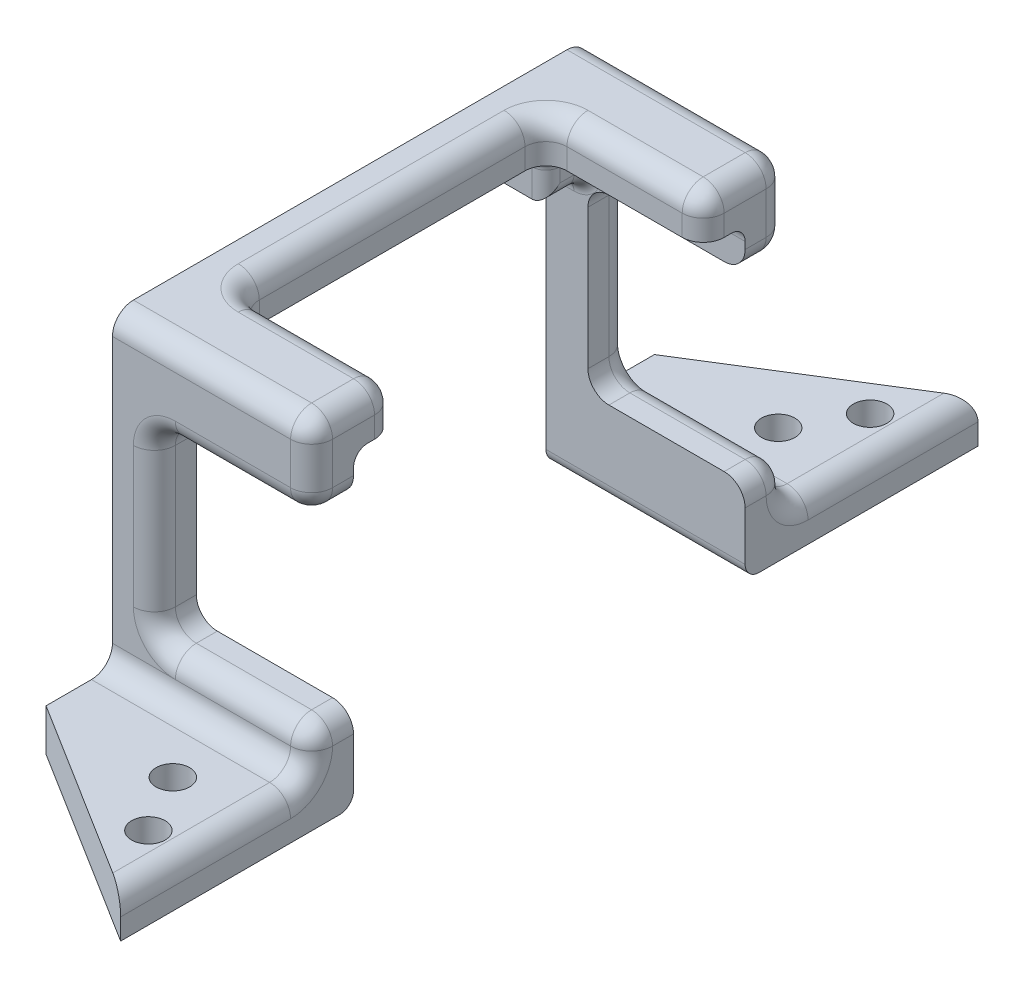
from build123d import *

# Parameters (mm, degrees)
SKETCH3_R           = 1.2
BOSS_EXTRUDE1_DEPTH = 25
SKETCH5_W           = 28
SKETCH5_H           = 22
CUT_EXTRUDE1_DEPTH  = 43.03807243
CUT_EXTRUDE2_DEPTH  = 22
SKETCH8_W           = 3
SKETCH8_H           = 3
BOSS_EXTRUDE2_DEPTH = 3
SKETCH9_W           = 11.23999152
SKETCH9_H           = 22
CUT_EXTRUDE3_DEPTH  = 47.686959369
SKETCH10_W          = 11.23999152
SKETCH10_H          = 13
CUT_EXTRUDE4_DEPTH  = 61.429893223
FILLET1_START       = -17
FILLET1_DEPTH       = 3
FILLET1_START_2     = 14
FILLET1_2_DEPTH     = 3
FILLET1_START_3     = 22
FILLET1_3_DEPTH     = 3
FILLET1_START_4     = -30.6499947
FILLET1_4_DEPTH     = 61.2999894
FILLET1_START_5     = 19.56628
FILLET1_5_DEPTH     = 6.43372
FILLET2_R           = 1
FILLET3_R           = 1
FILLET4_R           = 1.5


with BuildPart() as part:
    # Sketch3 → Boss-Extrude1 (new body)
    with BuildSketch(Plane(origin=(0, 0, 0), x_dir=(1, 0, 0), z_dir=(0, 1, 0))):
        Polygon((-13.26000848, 30.6499947), (-27.5, 21.75), (-27.5, -21.75), (-13.26000848, -30.6499947), align=None)
        with Locations(Location((-18.538627315, 21.642919742, 0), (0, 0, 270))):
            Circle(SKETCH3_R, mode=Mode.SUBTRACT)
        with Locations(Location((-16.127132138, 25.803411421, 0), (0, 0, 270))):
            Circle(SKETCH3_R, mode=Mode.SUBTRACT)
        with Locations(Location((-18.538627315, -21.642919742, 0), (0, 0, 270))):
            Circle(SKETCH3_R, mode=Mode.SUBTRACT)
        with Locations(Location((-16.127132138, -25.803411421, 0), (0, 0, 270))):
            Circle(SKETCH3_R, mode=Mode.SUBTRACT)
    extrude(amount=BOSS_EXTRUDE1_DEPTH)

    # Sketch5 → Cut-Extrude1 (cut, through all)
    with BuildSketch(Plane(origin=(-13.26000848, 0, 0), x_dir=(0, 0, -1), z_dir=(1, 0, 0))):
        with Locations((0, 11)):
            Rectangle(SKETCH5_W, SKETCH5_H)
    extrude(amount=-CUT_EXTRUDE1_DEPTH, mode=Mode.SUBTRACT)

    # Sketch6 → Cut-Extrude2 (cut)
    with BuildSketch(Plane(origin=(0, 25, 0), x_dir=(1, 0, 0), z_dir=(0, 1, 0))):
        Polygon((-13.26000848, -30.6499947), (-27.5, -21.75), (-27.5, -17), (-13.26000848, -17), align=None)
        Polygon((-27.5, 17), (-27.5, 21.75), (-13.26000848, 30.6499947), (-13.26000848, 17), align=None)
    extrude(amount=-CUT_EXTRUDE2_DEPTH, mode=Mode.SUBTRACT)

    # Sketch8 → Boss-Extrude2 (add)
    with BuildSketch(Plane.XZ.offset(-22)):
        with Locations((-26, -12.5)):
            Rectangle(SKETCH8_W, SKETCH8_H)
        with Locations((-26, 12.5)):
            Rectangle(SKETCH8_W, SKETCH8_H)
    extrude(amount=BOSS_EXTRUDE2_DEPTH)

    # Sketch9 → Cut-Extrude3 (cut, through all)
    with BuildSketch(Plane.XZ.offset(-22)):
        with Locations((-18.88000424, 0)):
            Rectangle(SKETCH9_W, SKETCH9_H)
    extrude(amount=-CUT_EXTRUDE3_DEPTH, mode=Mode.SUBTRACT)

    # Sketch10 → Cut-Extrude4 (cut, through all)
    with BuildSketch(Plane(origin=(0, 0, -17), x_dir=(-1, 0, 0), z_dir=(0, 0, -1))):
        with Locations((18.88000424, 12.5)):
            Rectangle(SKETCH10_W, SKETCH10_H)
    extrude(amount=-CUT_EXTRUDE4_DEPTH, mode=Mode.SUBTRACT)

    # Fillet1: read off the stored shape, not the designer's step
    # Fillet1 outline → Fillet1 (add)
    with BuildSketch(Plane.XY.offset(FILLET1_START)):
        with BuildLine():
            Line((-24.5, 19), (-24.5, 17.5))
            ThreePointArc((-24.5, 17.5), (-24.060660172, 18.560660172), (-23, 19))
            Line((-23, 19), (-24.5, 19))
        make_face()
        with BuildLine():
            Line((-24.5, 6), (-23, 6))
            ThreePointArc((-23, 6), (-24.060660172, 6.439339828), (-24.5, 7.5))
            Line((-24.5, 7.5), (-24.5, 6))
        make_face()
    extrude(amount=FILLET1_DEPTH)

    # Fillet1 2 outline → Fillet1 2 (add)
    with BuildSketch(Plane.XY.offset(FILLET1_START_2)):
        with BuildLine():
            Line((-24.5, 19), (-24.5, 17.5))
            ThreePointArc((-24.5, 17.5), (-24.060660172, 18.560660172), (-23, 19))
            Line((-23, 19), (-24.5, 19))
        make_face()
        with BuildLine():
            Line((-24.5, 6), (-23, 6))
            ThreePointArc((-23, 6), (-24.060660172, 6.439339828), (-24.5, 7.5))
            Line((-24.5, 7.5), (-24.5, 6))
        make_face()
    extrude(amount=FILLET1_2_DEPTH)

    # Fillet1 3 outline → Fillet1 3 (add)
    with BuildSketch(Plane(origin=(0, 0, 0), x_dir=(1, 0, 0), z_dir=(0, 1, 0)).offset(FILLET1_START_3)):
        with BuildLine():
            ThreePointArc((-23, -11), (-24.060660172, -10.560660172), (-24.5, -9.5))
            Line((-24.5, -9.5), (-24.5, -11))
            Line((-24.5, -11), (-23, -11))
        make_face()
        with BuildLine():
            ThreePointArc((-24.5, 9.5), (-24.060660172, 10.560660172), (-23, 11))
            Line((-23, 11), (-24.5, 11))
            Line((-24.5, 11), (-24.5, 9.5))
        make_face()
    extrude(amount=FILLET1_3_DEPTH)

    # Fillet1 4 outline → Fillet1 4 (cut)
    with BuildSketch(Plane.XY.offset(FILLET1_START_4)):
        with BuildLine():
            Line((-13.26000848, 6), (-14.76000848, 6))
            ThreePointArc((-14.76000848, 6), (-13.699348308, 5.560660172), (-13.26000848, 4.5))
            Line((-13.26000848, 4.5), (-13.26000848, 6))
        make_face()
        with BuildLine():
            ThreePointArc((-13.26000848, 20.5), (-13.699348308, 19.439339828), (-14.76000848, 19))
            Line((-14.76000848, 19), (-13.26000848, 19))
            Line((-13.26000848, 19), (-13.26000848, 20.5))
        make_face()
    extrude(amount=FILLET1_4_DEPTH, mode=Mode.SUBTRACT)

    # Fillet1 5 outline → Fillet1 5 (cut)
    with BuildSketch(Plane(origin=(0, 0, 0), x_dir=(1, 0, 0), z_dir=(0, 1, 0)).offset(FILLET1_START_5)):
        with BuildLine():
            Line((-13.26000848, 11), (-13.26000848, 12.5))
            ThreePointArc((-13.26000848, 12.5), (-13.699348308, 11.439339828), (-14.76000848, 11))
            Line((-14.76000848, 11), (-13.26000848, 11))
        make_face()
        with BuildLine():
            Line((-13.26000848, -11), (-14.76000848, -11))
            ThreePointArc((-14.76000848, -11), (-13.699348308, -11.439339828), (-13.26000848, -12.5))
            Line((-13.26000848, -12.5), (-13.26000848, -11))
        make_face()
    extrude(amount=FILLET1_5_DEPTH, mode=Mode.SUBTRACT)

    # Fillet2
    fillet2_edges = [part.edges().sort_by_distance(p)[0] for p in [
        (-24.5, 22, -12.5),
        (-24.5, 20.5, -14),
        (-26, 22, -11),
        (-24.5, 20.5, -11),
        (-26, 19, -14),
        (-24.5, 19, -12.5),
        (-24.5, 20.5, 14),
        (-26, 22, 11),
        (-24.5, 22, 12.5),
        (-24.5, 20.5, 11),
        (-26, 19, 14),
        (-24.5, 19, 12.5),
    ]]
    fillet(fillet2_edges, radius=FILLET2_R)

    # Fillet3
    # the kernel refuses this fillet: 1 mm, written as the material it adds along each edge
    with BuildSketch(Plane(origin=(-23.5, 21, 13), x_dir=(0, 1, 0), z_dir=(0, 0, 1))) as fillet3_piece_1_section:
        Polygon((0, 0), (FILLET3_R, 0), (FILLET3_R, FILLET3_R), (0, FILLET3_R), align=None)
    fillet3_piece_1 = extrude(amount=FILLET3_R, mode=Mode.PRIVATE)
    fillet3_piece_1 = fillet3_piece_1 - Plane(origin=(-23.5, 21, 13), x_dir=(0.7071067811865475, -0.7071067811865475, 0), z_dir=(0, 0, 1)) * Sphere(FILLET3_R, mode=Mode.PRIVATE)
    add(fillet3_piece_1)
    with BuildSketch(Plane(origin=(-23.5, 21, -13), x_dir=(0, 0, -1), z_dir=(0, 1, 0))) as fillet3_piece_2_section:
        Polygon((0, 0), (FILLET3_R, 0), (FILLET3_R, FILLET3_R), (0, FILLET3_R), align=None)
    fillet3_piece_2 = extrude(amount=FILLET3_R, mode=Mode.PRIVATE)
    fillet3_piece_2 = fillet3_piece_2 - Plane(origin=(-23.5, 21, -13), x_dir=(0.7071067811865691, 0, 0.707106781186526), z_dir=(0, 1, 0)) * Sphere(FILLET3_R, mode=Mode.PRIVATE)
    add(fillet3_piece_2)
    with BuildSketch(Plane(origin=(-13.26000848, 22, 14), x_dir=(0, -1, 0), z_dir=(-1, 0, 0)), Plane(origin=(-13.26000848, 22, -14), x_dir=(0, 0, 1), z_dir=(-1, 0, 0))) as fillet3_piece_3:
        with BuildLine():
            CenterArc((FILLET3_R, -FILLET3_R), FILLET3_R, 90, 90)
            Line((0, -FILLET3_R), (0, 0))
            Line((0, 0), (FILLET3_R, 0))
        make_face()
    extrude(amount=10.23999152)
    # the kernel refuses this fillet: 1 mm, written as the material it takes off along each edge
    with BuildSketch(Plane(origin=(-10.76000848, 0, 14), x_dir=(0, 1, 0), z_dir=(-1, 0, 0)), Plane(origin=(-10.76000848, 0, -14), x_dir=(0, 0, -1), z_dir=(-1, 0, 0))) as fillet3_2_piece_1:
        with BuildLine():
            CenterArc((FILLET3_R, -FILLET3_R), FILLET3_R, 90, 90)
            Line((0, -FILLET3_R), (0, 0))
            Line((0, 0), (FILLET3_R, 0))
        make_face()
    extrude(amount=19.23999152, mode=Mode.SUBTRACT)

    # Fillet4
    fillet4_edges = [part.edges().sort_by_distance(p)[0] for p in [
        (-13.26000848, 3, -23.82499735),
        (-13.26000848, 3, 23.82499735),
        (-13.699348308, 5.560660172, -17),
        (-18.88000424, 6, -17),
        (-24.060660172, 6.439339828, -17),
        (-24.5, 12.5, -17),
        (-24.060660172, 18.560660172, -17),
        (-18.88000424, 19, -17),
        (-13.699348308, 19.439339828, -17),
        (-13.26000848, 25, -14.75),
        (-13.699348308, 25, -11.439339828),
        (-18.88000424, 25, -11),
        (-24.060660172, 25, -10.560660172),
        (-24.5, 25, 0),
        (-24.060660172, 25, 10.560660172),
        (-18.88000424, 25, 11),
        (-13.699348308, 25, 11.439339828),
        (-13.699348308, 5.560660172, 17),
        (-18.88000424, 6, 17),
        (-24.060660172, 6.439339828, 17),
        (-24.5, 12.5, 17),
        (-24.060660172, 18.560660172, 17),
        (-18.88000424, 19, 17),
        (-13.699348308, 19.439339828, 17),
        (-20.38000424, 3, 17),
        (-20.38000424, 3, -17),
        (-13.26000848, 22.75, -17),
        (-13.26000848, 25, 14.75),
        (-13.26000848, 22.75, 17),
        (-20.38000424, 25, 17),
        (-20.38000424, 25, -17),
    ]]
    fillet(fillet4_edges, radius=FILLET4_R - 0.0001)  # a hair under: the kernel refuses the full size


solid = part.part
